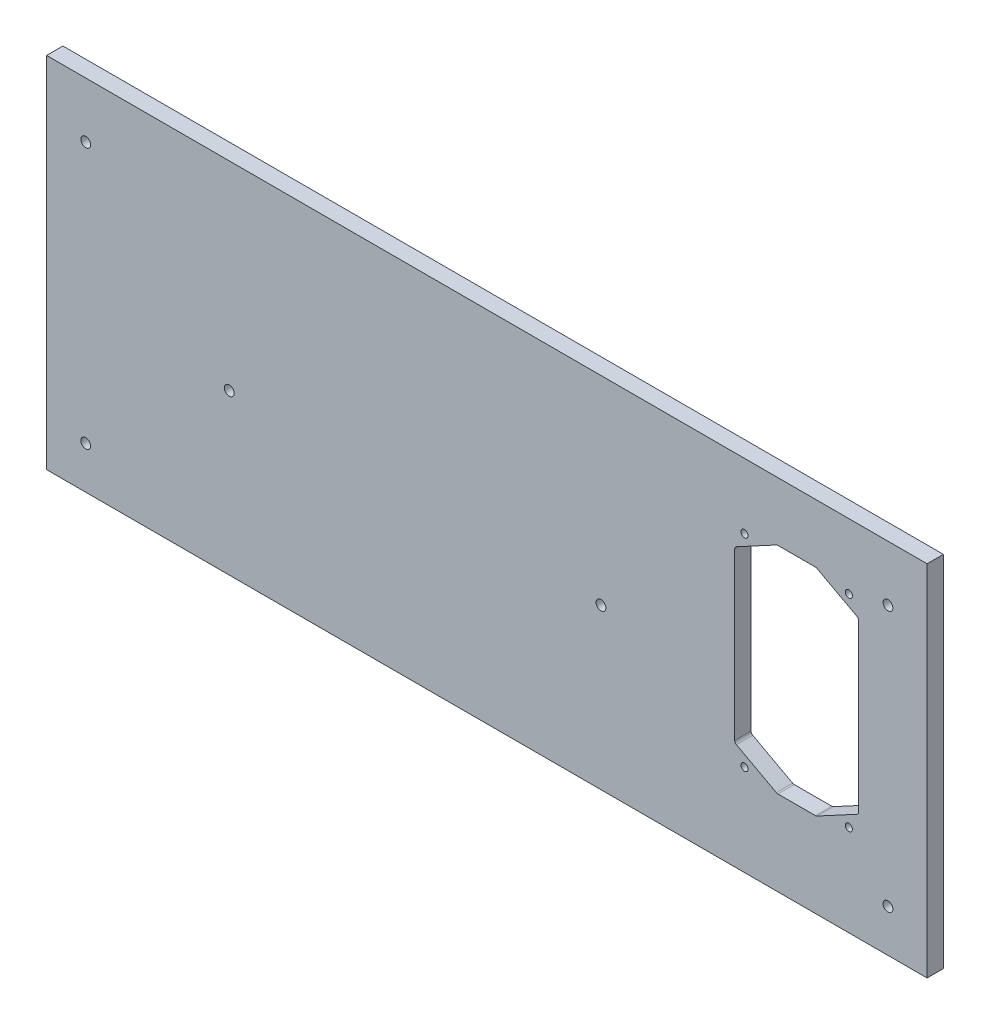
from build123d import *

# Parameters (mm, degrees)
SKETCH1_W             = 270
SKETCH1_H             = 110
BASE_DEPTH            = 2.5
SKETCH2_R             = 1.5
MOUNTHOLES_DEPTH      = 146.859521458
SKETCH3_R             = 1.5
MIDDLEPARTHOLES_DEPTH = 146.859521458
CHAMFERALL_SIZE       = 1.7
SKETCH4_R             = 1.1
CUT_EXTRUDE1_DEPTH    = 146.859521458
FILLET1_R             = 1


with BuildPart() as part:
    # Sketch1 → Base (new, symmetric)
    with BuildSketch(Plane.XY):
        Rectangle(SKETCH1_W, SKETCH1_H)
    extrude(amount=BASE_DEPTH, both=True)

    # Sketch2 → MountHoles (cut, through all)
    with BuildSketch(Plane.XY.offset(2.5)):
        with Locations((-123, -42)):
            Circle(SKETCH2_R)
        with Locations((123, -42)):
            Circle(SKETCH2_R)
        with Locations((123, 38)):
            Circle(SKETCH2_R)
        with Locations((-123, 38)):
            Circle(SKETCH2_R)
    extrude(amount=-MOUNTHOLES_DEPTH, mode=Mode.SUBTRACT)

    # Sketch3 → MiddlePartHoles (cut, through all)
    with BuildSketch(Plane(origin=(0, 0, -2.5), x_dir=(-1, 0, 0), z_dir=(0, 0, -1))):
        with Locations((-35, -6)):
            Circle(SKETCH3_R)
        with Locations((79, -6)):
            Circle(SKETCH3_R)
    extrude(amount=-MIDDLEPARTHOLES_DEPTH, mode=Mode.SUBTRACT)

    # ChamferAll
    chamferall_edges = [part.edges().sort_by_distance(p)[0] for p in [
        (-124.5, -42, -2.5),
        (121.5, -42, -2.5),
        (-124.5, 38, -2.5),
        (121.5, 38, -2.5),
        (-77.5, -6, -2.5),
        (36.5, -6, -2.5),
    ]]
    chamfer(chamferall_edges, length=CHAMFERALL_SIZE)

    # Sketch4 → Cut-Extrude1 (cut, through all)
    with BuildSketch(Plane(origin=(0, 0, -2.5), x_dir=(-1, 0, 0), z_dir=(0, 0, -1))):
        with Locations((-79, 35)):
            Circle(SKETCH4_R)
        with Locations((-111, 35)):
            Circle(SKETCH4_R)
        with Locations((-111, -27)):
            Circle(SKETCH4_R)
        with Locations((-79, -27)):
            Circle(SKETCH4_R)
        Polygon((-101, 37), (-114, 30), (-114, -22), (-101, -29), (-89, -29), (-76, -22), (-76, 30), (-89, 37), align=None)
    extrude(amount=-CUT_EXTRUDE1_DEPTH, mode=Mode.SUBTRACT)

    # Fillet1
    fillet1_edges = [part.edges().sort_by_distance(p)[0] for p in [
        (76, 30, 0),
        (89, -29, 0),
        (101, -29, 0),
        (114, -22, 0),
        (114, 30, 0),
        (101, 37, 0),
        (89, 37, 0),
        (76, -22, 0),
    ]]
    fillet(fillet1_edges, radius=FILLET1_R)


solid = part.part
